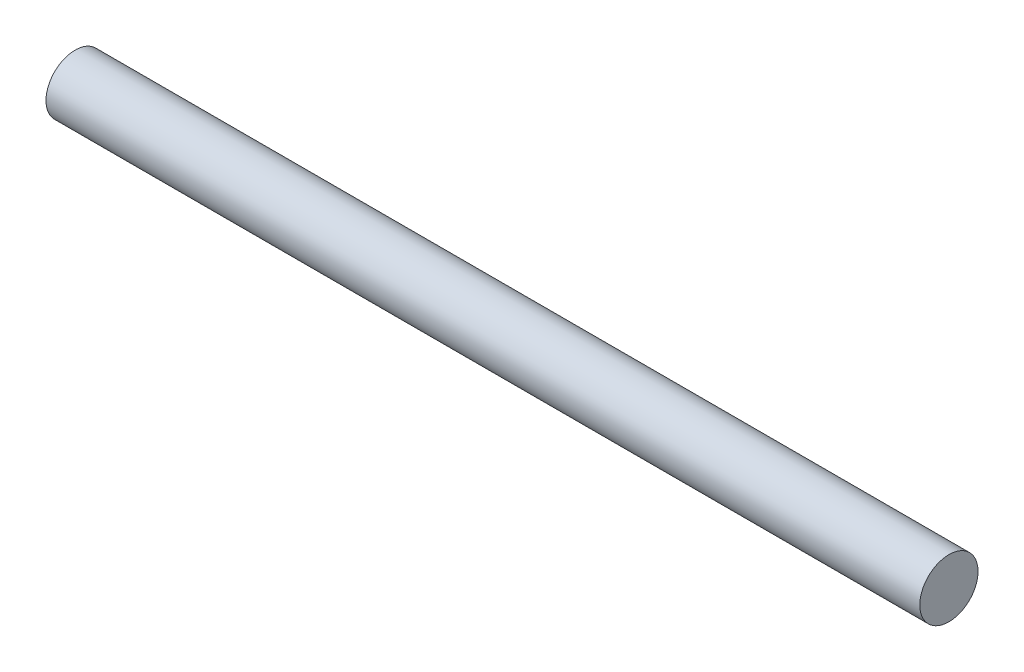
from build123d import *

# Parameters (mm, degrees)
SKETCH1_R           = 1.5
BOSS_EXTRUDE1_DEPTH = 45


with BuildPart() as part:
    # Sketch1 → Boss-Extrude1 (new body)
    with BuildSketch(Plane(origin=(0, 0, 0), x_dir=(0, 0, -1), z_dir=(1, 0, 0))):
        Circle(SKETCH1_R)
    extrude(amount=BOSS_EXTRUDE1_DEPTH)


solid = part.part
